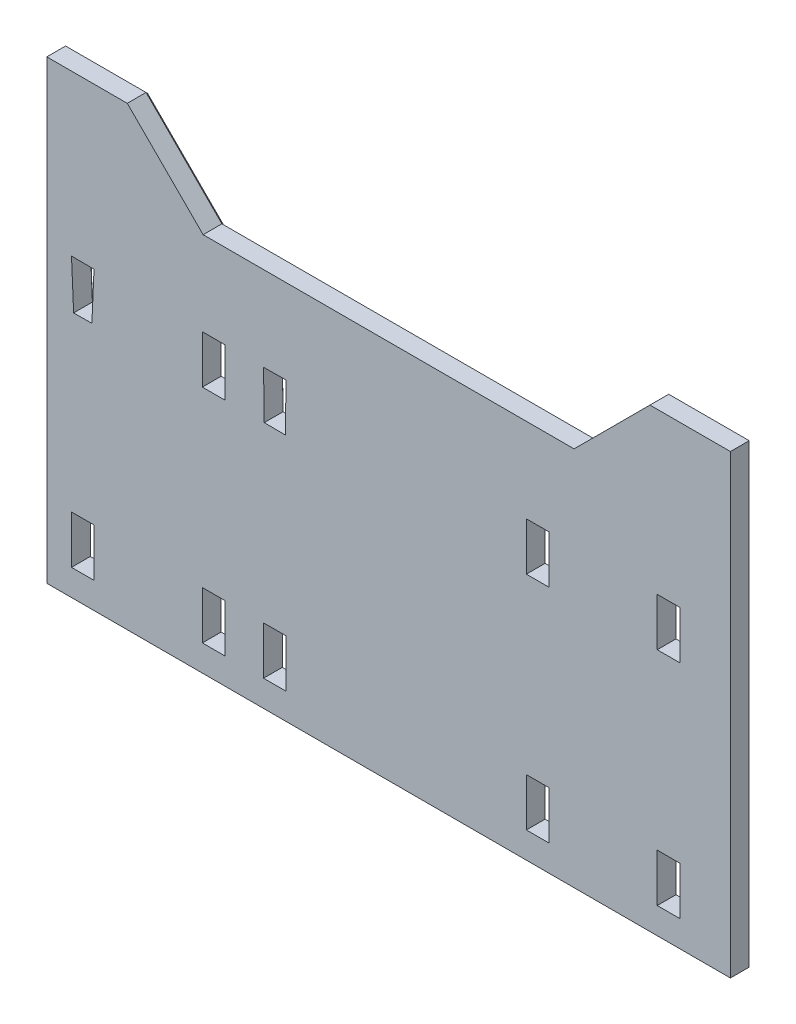
from build123d import *

# Parameters (mm, degrees)
SKETCH1_W           = 127.440194606
SKETCH1_H           = 60
SKETCH1_W_2         = 4.2
SKETCH1_H_2         = 8.94233751
BOSS_EXTRUDE1_DEPTH = 4
BOSS_EXTRUDE2_DEPTH = 4
CHAMFER1_SIZE       = 0.5


with BuildPart() as part:
    # Sketch1 → Boss-Extrude1 (new body)
    with BuildSketch(Plane.XY):
        Rectangle(SKETCH1_W, SKETCH1_H)
        with Locations((-32.620097303, 20.65)):
            Rectangle(SKETCH1_W_2, SKETCH1_H_2, mode=Mode.SUBTRACT)
        with Locations((27.7799027, 20.65)):
            Rectangle(SKETCH1_W_2, SKETCH1_H_2, mode=Mode.SUBTRACT)
        with Locations((27.7799027, -20.65)):
            Rectangle(SKETCH1_W_2, SKETCH1_H_2, mode=Mode.SUBTRACT)
        Polygon((-19.120157922, 25.120658183), (-23.320036683, 25.088745863), (-23.184900474, 16.211254137), (-19.255294131, 16.179341817), align=None, mode=Mode.SUBTRACT)
        with Locations((-21.220097303, -20.65)):
            Rectangle(SKETCH1_W_2, SKETCH1_H_2, mode=Mode.SUBTRACT)
        with Locations((52.1799027, 20.65)):
            Rectangle(SKETCH1_W_2, SKETCH1_H_2, mode=Mode.SUBTRACT)
        with Locations((52.1799027, -20.65)):
            Rectangle(SKETCH1_W_2, SKETCH1_H_2, mode=Mode.SUBTRACT)
        with Locations((-32.620097303, -20.65)):
            Rectangle(SKETCH1_W_2, SKETCH1_H_2, mode=Mode.SUBTRACT)
        Polygon((-59.120047726, 25.145614969), (-54.920146879, 25.11675542), (-55.31736749, 16.18324458), (-58.722827116, 16.154385031), align=None, mode=Mode.SUBTRACT)
        with Locations((-57.020097303, -20.65)):
            Rectangle(SKETCH1_W_2, SKETCH1_H_2, mode=Mode.SUBTRACT)
    extrude(amount=-BOSS_EXTRUDE1_DEPTH)

    # Sketch2 → Boss-Extrude2 (add)
    with BuildSketch(Plane.XY):
        Polygon((-63.720097303, 30), (-63.720097303, 55), (-48.720097303, 55), (-34.577961679, 40.857864376), (34.577961679, 40.857864376), (48.720097303, 55), (63.720097303, 55), (63.720097303, 30), align=None)
    extrude(amount=-BOSS_EXTRUDE2_DEPTH)

    # Chamfer1
    chamfer1_edges = [part.edges().sort_by_distance(p)[0] for p in [
        (56.220097303, 55, -4),
        (41.649029491, 47.928932188, -4),
        (0, 40.857864376, -4),
        (-41.649029491, 47.928932188, -4),
        (-56.220097303, 55, -4),
        (-63.720097303, 12.5, -4),
        (0, -30, -4),
        (63.720097303, 12.5, -4),
        (29.8799027, 20.65, -4),
        (27.7799027, 16.178831245, -4),
        (25.6799027, 20.65, -4),
        (27.7799027, 25.121168755, -4),
        (29.8799027, -20.65, -4),
        (27.7799027, -25.121168755, -4),
        (25.6799027, -20.65, -4),
        (27.7799027, -16.178831245, -4),
        (-23.252468578, 20.65, -4),
        (-21.220097303, 25.104702023, -4),
        (-19.187726027, 20.65, -4),
        (-21.220097303, 16.195297977, -4),
        (-23.320097303, -20.65, -4),
        (-21.220097303, -16.178831245, -4),
        (-19.120097303, -20.65, -4),
        (-21.220097303, -25.121168755, -4),
        (-30.520097303, 20.65, -4),
        (-32.620097303, 16.178831245, -4),
        (-34.720097303, 20.65, -4),
        (-32.620097303, 25.121168755, -4),
        (-30.520097303, -20.65, -4),
        (-32.620097303, -25.121168755, -4),
        (-34.720097303, -20.65, -4),
        (-32.620097303, -16.178831245, -4),
        (54.2799027, 20.65, -4),
        (52.1799027, 16.178831245, -4),
        (50.0799027, 20.65, -4),
        (52.1799027, 25.121168755, -4),
        (54.2799027, -20.65, -4),
        (52.1799027, -25.121168755, -4),
        (50.0799027, -20.65, -4),
        (52.1799027, -16.178831245, -4),
        (-55.118757184, 20.65, -4),
        (-57.020097303, 16.168814806, -4),
        (-58.921437421, 20.65, -4),
        (-57.020097303, 25.131185194, -4),
        (-54.920097303, -20.65, -4),
        (-57.020097303, -25.121168755, -4),
        (-59.120097303, -20.65, -4),
        (-57.020097303, -16.178831245, -4),
    ]]
    chamfer(chamfer1_edges, length=CHAMFER1_SIZE)


solid = part.part
